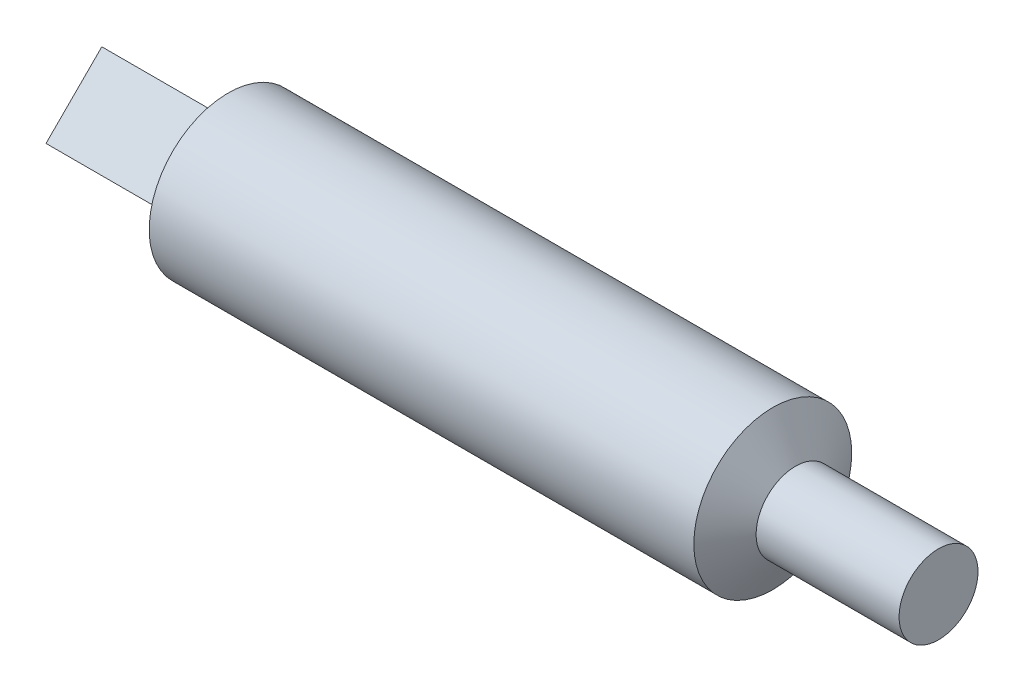
from build123d import *

# Parameters (mm, degrees)
SKETCH_1_R       = 5
EXTRUDE_1_DEPTH  = 37
SKETCH_2_R       = 2.5
EXTRUDE_2_DEPTH  = 8
EXTRUDE_3_DEPTH  = 8
CHAMFER_1_SIZE   = 2.5
CHAMFER_1_SIZE_2 = 4.330127019


with BuildPart() as part:
    # 草图1 → 凸台-拉伸1 (new body)
    with BuildSketch(Plane(origin=(0, 0, 0), x_dir=(0, 0, -1), z_dir=(1, 0, 0))):
        Circle(SKETCH_1_R)
    extrude(amount=EXTRUDE_1_DEPTH)

    # 草图2 → 凸台-拉伸2 (add)
    with BuildSketch(Plane(origin=(37, 0, 0), x_dir=(0, 0, -1), z_dir=(1, 0, 0))):
        Circle(SKETCH_2_R)
    extrude(amount=EXTRUDE_2_DEPTH)

    # 草图3 → 凸台-拉伸3 (add)
    with BuildSketch(Plane.ZY):
        Polygon((0, 3.535533906), (-3.535533906, 0), (0, -3.535533906), (3.535533906, 0), align=None)
    extrude(amount=EXTRUDE_3_DEPTH)

    # 倒角1
    # the kernel refuses this chamfer: 4.330127019, 2.5 mm, written as the material it takes off along each edge
    with BuildSketch(Plane(origin=(37, 0, 0), x_dir=(0, 0, -1), z_dir=(0, -1, 0))) as chamfer_1_piece_1_section:
        Polygon((5, -CHAMFER_1_SIZE), (5 - CHAMFER_1_SIZE_2, 0), (5, 0), align=None)
    chamfer_1_piece_1 = revolve(axis=Axis((37, 0, 0), (1, 0, 0)), mode=Mode.PRIVATE)
    chamfer_1_piece_1 = chamfer_1_piece_1 - Plane(origin=(35.221489766, 0, 0), x_dir=(0, 0, -1), z_dir=(-1, 0, 0)) * Cylinder(2.5, 20, mode=Mode.PRIVATE)
    add(chamfer_1_piece_1, mode=Mode.SUBTRACT)


solid = part.part
